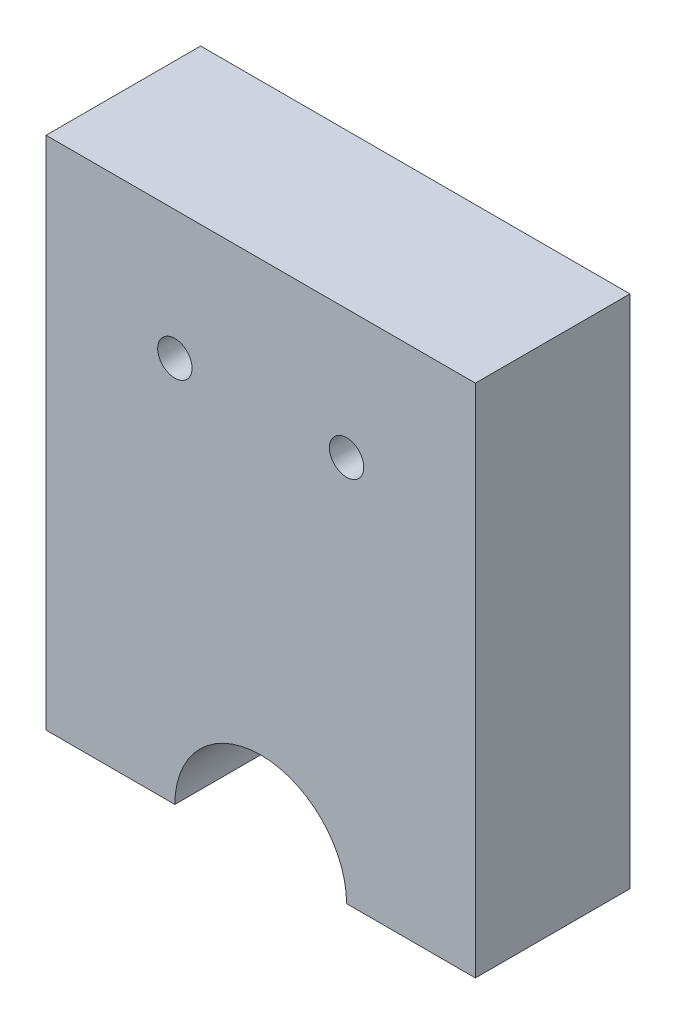
from build123d import *

# Parameters (mm, degrees)
SKETCH1_W           = 25
SKETCH1_H           = 30
BOSS_EXTRUDE1_DEPTH = 9
CUT_EXTRUDE3_DEPTH  = 41.074929819
SKETCH5_R           = 1
CUT_EXTRUDE4_DEPTH  = 41.074929819


with BuildPart() as part:
    # Sketch1 → Boss-Extrude1 (new body)
    with BuildSketch(Plane.XY):
        with Locations((12.5, 15)):
            Rectangle(SKETCH1_W, SKETCH1_H)
    extrude(amount=BOSS_EXTRUDE1_DEPTH)

    # Sketch4 → Cut-Extrude3 (cut, through all)
    with BuildSketch(Plane.XY.offset(9)):
        with BuildLine():
            ThreePointArc((17.5, 0), (12.5, 5), (7.5, 0))
            Line((7.5, 0), (17.5, 0))
        make_face()
    extrude(amount=-CUT_EXTRUDE3_DEPTH, mode=Mode.SUBTRACT)

    # Sketch5 → Cut-Extrude4 (cut, through all)
    with BuildSketch(Plane.XY.offset(9)):
        with Locations((7.5, 22.5)):
            Circle(SKETCH5_R)
        with Locations((17.5, 22.5)):
            Circle(SKETCH5_R)
    extrude(amount=-CUT_EXTRUDE4_DEPTH, mode=Mode.SUBTRACT)


solid = part.part
